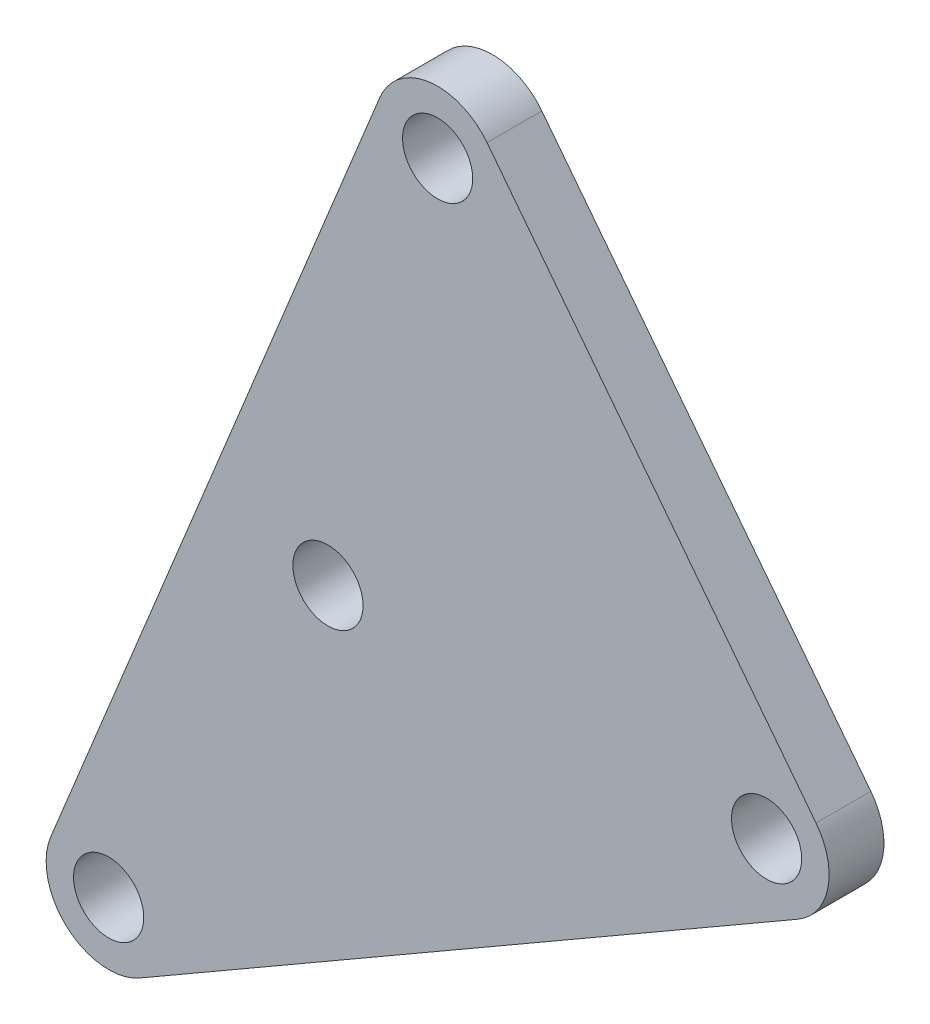
from build123d import *

# Parameters (mm, degrees)
SKETCH1_R           = 2.032
BOSS_EXTRUDE1_DEPTH = 3.175


with BuildPart() as part:
    # Sketch1 → Boss-Extrude1 (new body)
    with BuildSketch(Plane.XY):
        with BuildLine():
            Line((9.211465998, 26.809926279), (28.261465998, 2.216482031))
            ThreePointArc((28.261465998, 2.216482031), (28.951552918, -0.698034471), (27.20975, -3.134578949))
            Line((27.20975, -3.134578949), (-10.89025, -25.131624205))
            ThreePointArc((-10.89025, -25.131624205), (-15.080292043, -24.72376307), (-16.050262745, -20.627184026))
            Line((-16.050262745, -20.627184026), (2.999737255, 25.963305479))
            ThreePointArc((2.999737255, 25.963305479), (5.861203253, 28.17978751), (9.211465998, 26.809926279))
        make_face()
        Circle(SKETCH1_R, mode=Mode.SUBTRACT)
        with Locations((6.35, 24.593444248)):
            Circle(SKETCH1_R, mode=Mode.SUBTRACT)
        with Locations((-12.7, -21.997045256)):
            Circle(SKETCH1_R, mode=Mode.SUBTRACT)
        with Locations((25.4, 0)):
            Circle(SKETCH1_R, mode=Mode.SUBTRACT)
    extrude(amount=BOSS_EXTRUDE1_DEPTH)


solid = part.part
